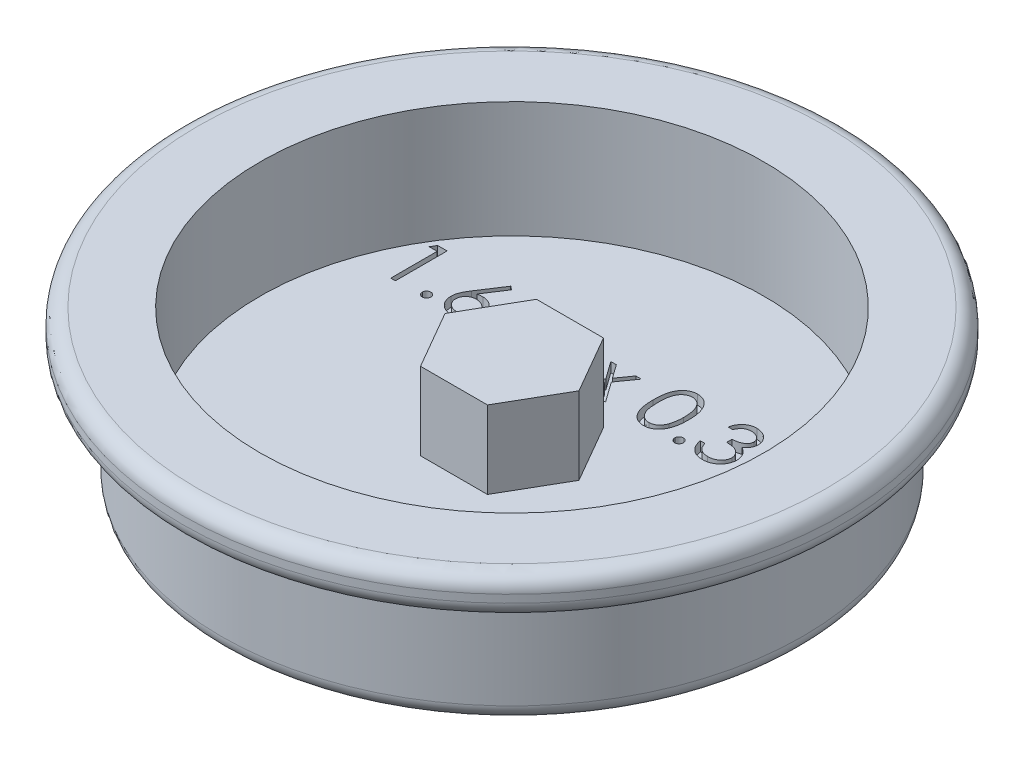
from build123d import *

# Parameters (mm, degrees)
BOSS_EXTRUDE1_DEPTH = 6.35
CUT_EXTRUDE1_DEPTH  = 0.79375


with BuildPart() as part:
    # Sketch1 → Revolve1 (revolve)
    with BuildSketch(Plane.XY):
        with BuildLine():
            Line((0, 0), (22.5425, 0))
            ThreePointArc((22.5425, 0), (23.440525612, 0.371974388), (23.8125, 1.27))
            Line((23.8125, 1.27), (23.8125, 8.255))
            ThreePointArc((23.8125, 8.255), (24.184474388, 9.153025612), (25.0825, 9.525))
            Line((25.0825, 9.525), (25.7175, 9.525))
            ThreePointArc((25.7175, 9.525), (26.615525612, 9.896974388), (26.9875, 10.795))
            Line((26.9875, 10.795), (26.9875, 11.43))
            ThreePointArc((26.9875, 11.43), (26.615525612, 12.328025612), (25.7175, 12.7))
            Line((25.7175, 12.7), (20.6375, 12.7))
            Line((20.6375, 12.7), (20.6375, 3.175))
            Line((20.6375, 3.175), (0, 3.175))
            Line((0, 3.175), (0, 0))
        make_face()
    revolve(axis=Axis((0, 3.175, 0), (0, -1, 0)))

    # Sketch2 → Boss-Extrude1 (add)
    with BuildSketch(Plane(origin=(0, 3.175, 0), x_dir=(1, 0, 0), z_dir=(0, 1, 0))):
        Polygon((2.742298309, 4.7498), (-2.742298309, 4.7498), (-5.484596617, 0), (-2.742298309, -4.7498), (2.742298309, -4.7498), (5.484596617, 0), align=None)
    extrude(amount=BOSS_EXTRUDE1_DEPTH)

    # Sketch3 → Cut-Extrude1 (cut)
    # profile 1 of 11: a face of its own
    with BuildSketch(Plane(origin=(0, 3.175, 0), x_dir=(1, 0, 0), z_dir=(0, 1, 0))):
        Polygon((-16.964111851, 10.86829198), (-16.181386156, 10.86829198), (-16.181386156, 6.634958647), (-16.561300686, 6.634958647), (-16.561300686, 10.434103946), (-17.212582738, 10.434103946), align=None)
    # profile 2 of 11: a face of its own
    with BuildSketch(Plane(origin=(0, 3.175, 0), x_dir=(1, 0, 0), z_dir=(0, 1, 0))):
        with BuildLine():
            add(Edge.make_bspline(
                [(-13.929035729, 7.286240698), (-13.905461853, 7.284839868), (-13.859248026, 7.282093704), (-13.792434985, 7.263253346), (-13.731965254, 7.229799538), (-13.678102444, 7.18521313), (-13.633705086, 7.131152661), (-13.59905906, 7.071165229), (-13.580382821, 7.003792826), (-13.577656661, 6.957311219), (-13.576257951, 6.93346292)],
                knots=[0, 0, 0, 0, 1.020151414, 1.999887582, 2.974338812, 3.990962822, 5.007586832, 5.987933904, 6.967670073, 8, 8, 8, 8], degree=3))
            add(Edge.make_bspline(
                [(-13.576257951, 6.93346292), (-13.577704059, 6.910187655), (-13.580555762, 6.864289173), (-13.59901625, 6.797424928), (-13.63396913, 6.737400005), (-13.677796216, 6.682605991), (-13.731978569, 6.637925128), (-13.792577945, 6.60475594), (-13.859091181, 6.584566593), (-13.905435687, 6.581994786), (-13.929035729, 6.580685143)],
                knots=[0, 0, 0, 0, 1.009421747, 1.99056486, 2.972319754, 3.999869655, 5.017953583, 5.993804169, 6.978383603, 8, 8, 8, 8], degree=3))
            add(Edge.make_bspline(
                [(-13.929035729, 6.580685143), (-13.952652777, 6.581947398), (-13.998759441, 6.584411652), (-14.065024405, 6.605170475), (-14.125992834, 6.637614089), (-14.180164637, 6.682689303), (-14.224358789, 6.737118048), (-14.257772347, 6.797838316), (-14.277838527, 6.864097769), (-14.280477554, 6.910149956), (-14.281813507, 6.93346292)],
                knots=[0, 0, 0, 0, 1.022052826, 1.995314843, 2.982371812, 4.00089066, 5.028879526, 6.005146991, 6.990147033, 8, 8, 8, 8], degree=3))
            add(Edge.make_bspline(
                [(-14.281813507, 6.93346292), (-14.280528873, 6.957350265), (-14.278020782, 7.003987375), (-14.257730221, 7.070752009), (-14.224618041, 7.131431931), (-14.179859135, 7.185130652), (-14.126005939, 7.23010958), (-14.065171481, 7.262845092), (-13.998599847, 7.282246352), (-13.952625921, 7.284886158), (-13.929035729, 7.286240698)],
                knots=[0, 0, 0, 0, 1.032775665, 2.016367738, 2.991239715, 4.008302682, 5.025365648, 6.011011707, 6.979408107, 8, 8, 8, 8], degree=3))
        make_face()
    # profile 3 of 11: a face of its own
    with BuildSketch(Plane(origin=(0, 3.175, 0), x_dir=(1, 0, 0), z_dir=(0, 1, 0))):
        with BuildLine():
            Line((-11.079676755, 10.976838989), (-10.787108646, 10.747024619))
            Line((-10.787108646, 10.747024619), (-11.905651648, 9.036561211))
            add(Edge.make_bspline(
                [(-11.905651648, 9.036561211), (-11.831180932, 9.048431309), (-11.68591738, 9.071585278), (-11.538880532, 9.075404888), (-11.467223496, 9.077266339)],
                knots=[0, 0, 0, 0, 1.025318673, 2, 2, 2, 2], degree=3))
            add(Edge.make_bspline(
                [(-11.467223496, 9.077266339), (-11.424197715, 9.076109899), (-11.339502745, 9.073833482), (-11.21515547, 9.05631492), (-11.0956679, 9.028707403), (-10.981535283, 8.988463818), (-10.872347962, 8.937056208), (-10.76747935, 8.875444432), (-10.668900728, 8.800447085), (-10.575342635, 8.716669472), (-10.490401289, 8.623878452), (-10.415197869, 8.525421597), (-10.352028321, 8.421401484), (-10.300776054, 8.311870799), (-10.26097682, 8.19699838), (-10.231963192, 8.076931202), (-10.214812637, 7.95158647), (-10.21248371, 7.866341439), (-10.211300686, 7.823039576)],
                knots=[0, 0, 0, 0, 1.04369286, 2.054478336, 3.041073146, 4.015093852, 4.984733326, 5.965804835, 6.960378782, 7.985147595, 9.009457201, 10.008161701, 10.986880575, 11.956520048, 12.937015923, 13.931873656, 14.949455224, 16, 16, 16, 16], degree=3))
            add(Edge.make_bspline(
                [(-10.211300686, 7.823039576), (-10.213021966, 7.763797458), (-10.216409036, 7.64722299), (-10.250159341, 7.477434021), (-10.302603864, 7.31568136), (-10.37756716, 7.164547524), (-10.470679186, 7.024239654), (-10.584226369, 6.899918186), (-10.714181826, 6.789041093), (-10.861123001, 6.696323087), (-11.019259729, 6.620603207), (-11.185390241, 6.566216676), (-11.35790117, 6.53273286), (-11.474988648, 6.528535084), (-11.534217353, 6.526411638)],
                knots=[0, 0, 0, 0, 1.031375318, 2.029502543, 3.004789286, 3.987476834, 4.960371455, 5.9300674, 6.912260825, 7.929083631, 8.949397511, 9.960523116, 10.96833055, 12, 12, 12, 12], degree=3))
            add(Edge.make_bspline(
                [(-11.534217353, 6.526411638), (-11.591181934, 6.52826004), (-11.704018795, 6.531921399), (-11.870005127, 6.564537343), (-12.029496586, 6.617402124), (-12.181375742, 6.690232728), (-12.322068293, 6.782226548), (-12.447938158, 6.892973305), (-12.558357733, 7.020105705), (-12.650250846, 7.16360403), (-12.723135217, 7.317806169), (-12.777793507, 7.478596825), (-12.809720392, 7.645390136), (-12.814181789, 7.7584578), (-12.816428892, 7.815407365)],
                knots=[0, 0, 0, 0, 1.012016664, 2.004627821, 2.994792927, 3.992885782, 4.990978636, 5.973936114, 6.964471063, 7.975201453, 8.993600317, 9.990122807, 10.98767138, 12, 12, 12, 12], degree=3))
            add(Edge.make_bspline(
                [(-12.816428892, 7.815407365), (-12.814999906, 7.859004146), (-12.81208219, 7.948020445), (-12.791709708, 8.08283884), (-12.758974194, 8.220786339), (-12.72231323, 8.33781284), (-12.683577492, 8.433681538), (-12.65134061, 8.510974331), (-12.611215872, 8.590513915), (-12.568430926, 8.675027742), (-12.519134522, 8.762337741), (-12.465533689, 8.853903132), (-12.406146492, 8.948267673), (-12.364514486, 9.012304938), (-12.343231776, 9.045041446)],
                knots=[0, 0, 0, 0, 1.173818275, 2.396712641, 3.66331629, 4.989737886, 5.693666774, 6.447286557, 7.243889047, 8.091586357, 8.998013824, 9.943181721, 10.948533338, 12, 12, 12, 12], degree=3))
            Line((-12.343231776, 9.045041446), (-11.079676755, 10.976838989))
        make_face()
        with BuildLine():
            add(Edge.make_bspline(
                [(-11.546937706, 8.643078305), (-11.579186326, 8.642137243), (-11.642177248, 8.640299075), (-11.734593836, 8.629624722), (-11.822058435, 8.609523567), (-11.905729825, 8.583922384), (-11.984043714, 8.548721541), (-12.057569263, 8.505962698), (-12.126590802, 8.455620892), (-12.190385383, 8.398409314), (-12.248224405, 8.335770455), (-12.298033963, 8.268678747), (-12.340999152, 8.198751092), (-12.375932399, 8.125403219), (-12.403134681, 8.048663167), (-12.422811518, 7.968883885), (-12.433762246, 7.88553039), (-12.435584069, 7.829006316), (-12.436514362, 7.800142942)],
                knots=[0, 0, 0, 0, 1.129588631, 2.206414736, 3.251139165, 4.268635594, 5.265702196, 6.250456724, 7.242448911, 8.251968645, 9.246821453, 10.222880186, 11.173611482, 12.116736599, 13.062300278, 14.020270554, 14.989073742, 16, 16, 16, 16], degree=3))
            add(Edge.make_bspline(
                [(-12.436514362, 7.800142942), (-12.435756762, 7.771537728), (-12.434271223, 7.715447162), (-12.420782227, 7.632789298), (-12.400177889, 7.553245075), (-12.369528077, 7.47722457), (-12.332967936, 7.403569023), (-12.284701496, 7.334946345), (-12.231220241, 7.267188736), (-12.16729215, 7.205501242), (-12.098683892, 7.148101325), (-12.025385295, 7.097929971), (-11.94899182, 7.055008599), (-11.8684721, 7.021370415), (-11.78496853, 6.993763896), (-11.697785384, 6.974337155), (-11.606862026, 6.963354042), (-11.545270729, 6.961529846), (-11.513864789, 6.960599673)],
                knots=[0, 0, 0, 0, 0.989467248, 1.94019797, 2.891935182, 3.827694429, 4.772920941, 5.730924762, 6.725747692, 7.756678648, 8.79901574, 9.819492441, 10.826891316, 11.826466727, 12.835195252, 13.867842842, 14.912794438, 16, 16, 16, 16], degree=3))
            add(Edge.make_bspline(
                [(-11.513864789, 6.960599673), (-11.4824589, 6.961529919), (-11.420867705, 6.963354258), (-11.329943615, 6.974336334), (-11.242763172, 6.993766908), (-11.159249776, 7.021359497), (-11.078766331, 7.055049101), (-11.002439668, 7.097662946), (-10.929834259, 7.14840987), (-10.861180963, 7.20540315), (-10.797518961, 7.267539837), (-10.742755014, 7.334341502), (-10.695966723, 7.404123642), (-10.657946325, 7.476934423), (-10.627634096, 7.553291041), (-10.606925274, 7.632776983), (-10.593464134, 7.715450386), (-10.591974767, 7.771538817), (-10.591215216, 7.800142942)],
                knots=[0, 0, 0, 0, 1.087397944, 2.132534446, 3.165364764, 4.174271784, 5.174024072, 6.181601208, 7.194203697, 8.236725232, 9.267838612, 10.269026844, 11.221737037, 12.171628256, 13.107553087, 14.05945871, 15.010357665, 16, 16, 16, 16], degree=3))
            add(Edge.make_bspline(
                [(-10.591215216, 7.800142942), (-10.591880809, 7.82904397), (-10.59318715, 7.885767289), (-10.607962631, 7.968846599), (-10.628454836, 8.049068515), (-10.65939812, 8.125928854), (-10.699598513, 8.199124308), (-10.748564157, 8.269024626), (-10.805209266, 8.336165712), (-10.870641528, 8.398532157), (-10.941870668, 8.45555767), (-11.01760571, 8.505897515), (-11.096839164, 8.54838201), (-11.179490694, 8.583829648), (-11.266507324, 8.609410441), (-11.35648421, 8.629552935), (-11.450572151, 8.640271756), (-11.514406715, 8.642130873), (-11.546937706, 8.643078305)],
                knots=[0, 0, 0, 0, 0.978206639, 1.919901502, 2.851605144, 3.780102724, 4.718870031, 5.675451981, 6.667674623, 7.690630536, 8.733308323, 9.756129687, 10.767539656, 11.776269907, 12.797430371, 13.836405707, 14.897401972, 16, 16, 16, 16], degree=3))
        make_face(mode=Mode.SUBTRACT)
    # profile 4 of 11: a face of its own
    with BuildSketch(Plane(origin=(0, 3.175, 0), x_dir=(1, 0, 0), z_dir=(0, 1, 0))):
        with BuildLine():
            Line((-9.234377609, 9.565727878), (-9.614292139, 9.565727878))
            add(Edge.make_bspline(
                [(-9.614292139, 9.565727878), (-9.611816059, 9.616129809), (-9.606953103, 9.71511786), (-9.584179839, 9.859442965), (-9.551594207, 9.99739496), (-9.505521686, 10.127866189), (-9.448303617, 10.25201027), (-9.379687298, 10.369334099), (-9.298414736, 10.479390108), (-9.206240877, 10.581158042), (-9.106130237, 10.674518247), (-8.998112577, 10.75513935), (-8.884604782, 10.823256915), (-8.765951223, 10.880202798), (-8.640813208, 10.922947183), (-8.510326323, 10.95466288), (-8.373917272, 10.973744746), (-8.280977436, 10.975795839), (-8.233709874, 10.976838989)],
                knots=[0, 0, 0, 0, 1.10065271, 2.161652631, 3.183658789, 4.190468796, 5.17591951, 6.163126047, 7.15150782, 8.156236427, 9.156009102, 10.134482811, 11.092018607, 12.041330605, 13.001268258, 13.972401359, 14.968799086, 16, 16, 16, 16], degree=3))
            add(Edge.make_bspline(
                [(-8.233709874, 10.976838989), (-8.18729068, 10.975752284), (-8.096078621, 10.973616949), (-7.962955994, 10.955279323), (-7.836225362, 10.926558465), (-7.716134444, 10.886262675), (-7.603641395, 10.832094844), (-7.497901141, 10.76702544), (-7.397654827, 10.691769073), (-7.307416146, 10.603166841), (-7.224553993, 10.508579195), (-7.153068408, 10.407598588), (-7.091850582, 10.303302214), (-7.040823578, 10.19489477), (-7.003260439, 10.081355526), (-6.974742035, 9.964337481), (-6.958622211, 9.842629376), (-6.956148222, 9.760252875), (-6.95489043, 9.718372108)],
                knots=[0, 0, 0, 0, 1.111607364, 2.184268762, 3.212621178, 4.221274766, 5.211760367, 6.196651075, 7.1921475, 8.207485113, 9.220403448, 10.201281604, 11.166441695, 12.114753415, 13.065576456, 14.026450734, 14.996634279, 16, 16, 16, 16], degree=3))
            add(Edge.make_bspline(
                [(-6.95489043, 9.718372108), (-6.956938472, 9.659410442), (-6.960998615, 9.542521802), (-6.995729337, 9.370751445), (-7.04997226, 9.204328928), (-7.115283349, 9.070389525), (-7.181169067, 8.962459489), (-7.240541576, 8.873597342), (-7.310046633, 8.777917394), (-7.390695864, 8.675740043), (-7.480820957, 8.566264949), (-7.58123824, 8.449558244), (-7.692663785, 8.326825722), (-7.770869781, 8.242998947), (-7.811394169, 8.199562012)],
                knots=[0, 0, 0, 0, 1.184426356, 2.348067706, 3.509069118, 4.696110526, 5.333549288, 6.050745305, 6.844228056, 7.710549037, 8.667450064, 9.695053472, 10.805634456, 12, 12, 12, 12], degree=3))
            Line((-7.811394169, 8.199562012), (-8.870575526, 7.069146681))
            Line((-8.870575526, 7.069146681), (-6.900616926, 7.069146681))
            Line((-6.900616926, 7.069146681), (-6.900616926, 6.634958647))
            Line((-6.900616926, 6.634958647), (-9.777112652, 6.634958647))
            Line((-9.777112652, 6.634958647), (-8.135339148, 8.386975207))
            add(Edge.make_bspline(
                [(-8.135339148, 8.386975207), (-8.095366942, 8.42870173), (-8.018588515, 8.508849841), (-7.909994351, 8.625862755), (-7.812459574, 8.734416961), (-7.725352823, 8.834307358), (-7.650563726, 8.926995064), (-7.584194455, 9.009478182), (-7.531017026, 9.085381183), (-7.473304119, 9.173362688), (-7.417407208, 9.2807833), (-7.369374168, 9.412057381), (-7.340085732, 9.547194154), (-7.336572264, 9.638515665), (-7.33480496, 9.684451168)],
                knots=[0, 0, 0, 0, 1.329631726, 2.553950428, 3.673215718, 4.687767853, 5.603093632, 6.413772471, 7.123043292, 7.734684054, 8.834405432, 9.900288307, 10.943827018, 12, 12, 12, 12], degree=3))
            add(Edge.make_bspline(
                [(-7.33480496, 9.684451168), (-7.335573905, 9.713336288), (-7.337089349, 9.770263313), (-7.350463898, 9.853727422), (-7.370675653, 9.934239149), (-7.399638012, 10.012046145), (-7.437867117, 10.086366124), (-7.484401586, 10.157289553), (-7.538092425, 10.225856206), (-7.600203008, 10.290146385), (-7.668434084, 10.349027463), (-7.740514748, 10.401187071), (-7.81677535, 10.444777233), (-7.896894355, 10.480510797), (-7.980648399, 10.508541972), (-8.068199471, 10.527965206), (-8.159305663, 10.54016021), (-8.2215157, 10.541810209), (-8.253214415, 10.542650955)],
                knots=[0, 0, 0, 0, 0.991446411, 1.95395049, 2.89581595, 3.838931463, 4.798493298, 5.75982156, 6.748411868, 7.785213223, 8.824556874, 9.840280684, 10.836137867, 11.835679398, 12.848801643, 13.863922112, 14.911575587, 16, 16, 16, 16], degree=3))
            add(Edge.make_bspline(
                [(-8.253214415, 10.542650955), (-8.286320089, 10.541786106), (-8.351334166, 10.540087686), (-8.446788616, 10.52820694), (-8.537848556, 10.507710543), (-8.624743048, 10.479677803), (-8.707619119, 10.444046987), (-8.786073724, 10.399667448), (-8.859930743, 10.346710271), (-8.929329014, 10.286668836), (-8.993269255, 10.219821357), (-9.049447857, 10.145302639), (-9.098535189, 10.064473289), (-9.1413635, 9.977551404), (-9.176144192, 9.883748261), (-9.20272124, 9.783396847), (-9.223751045, 9.67693289), (-9.230776589, 9.603411883), (-9.234377609, 9.565727878)],
                knots=[0, 0, 0, 0, 1.031018746, 2.02475058, 2.990194455, 3.934040569, 4.864654155, 5.795059489, 6.735614925, 7.690564532, 8.649604399, 9.611025574, 10.590972636, 11.591080095, 12.624614302, 13.701020113, 14.821632451, 16, 16, 16, 16], degree=3))
        make_face()
    # profile 5 of 11: a face of its own
    with BuildSketch(Plane(origin=(0, 3.175, 0), x_dir=(1, 0, 0), z_dir=(0, 1, 0))):
        with BuildLine():
            Line((-3.861300686, 10.86829198), (-3.861300686, 10.434103946))
            Line((-3.861300686, 10.434103946), (-5.301244597, 10.434103946))
            Line((-5.301244597, 10.434103946), (-5.529362919, 9.320649085))
            add(Edge.make_bspline(
                [(-5.529362919, 9.320649085), (-5.484542957, 9.333022842), (-5.397711369, 9.35699504), (-5.269550394, 9.383611543), (-5.147881729, 9.399656414), (-5.068929614, 9.401847237), (-5.030725099, 9.402907365)],
                knots=[0, 0, 0, 0, 1.100273476, 2.13160584, 3.095893838, 4, 4, 4, 4], degree=3))
            add(Edge.make_bspline(
                [(-5.030725099, 9.402907365), (-4.983452385, 9.401884186), (-4.890502419, 9.399872359), (-4.754504835, 9.380554027), (-4.624683145, 9.350146702), (-4.50130885, 9.307667595), (-4.384153708, 9.253348203), (-4.27429561, 9.185493989), (-4.170085562, 9.106229865), (-4.073393092, 9.015098279), (-3.985673214, 8.914802609), (-3.908546731, 8.806964041), (-3.843035789, 8.692630583), (-3.790348019, 8.570709847), (-3.748275538, 8.442549728), (-3.720272649, 8.306801748), (-3.701625773, 8.16474545), (-3.699542505, 8.06761516), (-3.698480174, 8.018084982)],
                knots=[0, 0, 0, 0, 1.052922333, 2.070308379, 3.05430497, 4.020497103, 4.973039431, 5.925935799, 6.892292201, 7.88610001, 8.88166317, 9.857072816, 10.836096531, 11.812156883, 12.81219415, 13.836441305, 14.89672472, 16, 16, 16, 16], degree=3))
            add(Edge.make_bspline(
                [(-3.698480174, 8.018084982), (-3.699284598, 7.983586678), (-3.700882576, 7.915056283), (-3.709008867, 7.813281869), (-3.724654924, 7.713662061), (-3.7456616, 7.616183645), (-3.772927191, 7.521031166), (-3.805933951, 7.42793227), (-3.846327242, 7.337466413), (-3.890633762, 7.248777601), (-3.94052236, 7.163870836), (-3.995892554, 7.084466823), (-4.054391767, 7.009374407), (-4.117337062, 6.939398939), (-4.185313504, 6.875000241), (-4.257497845, 6.815796129), (-4.333314086, 6.760785378), (-4.413935188, 6.712200989), (-4.497564668, 6.667493414), (-4.585410226, 6.630816373), (-4.675472216, 6.598025544), (-4.769046875, 6.571888306), (-4.865922248, 6.551407978), (-4.966258024, 6.537497728), (-5.069527978, 6.527366227), (-5.139529183, 6.526732005), (-5.174889094, 6.526411638)],
                knots=[0, 0, 0, 0, 1.056347294, 2.098418968, 3.122841568, 4.141288669, 5.149314143, 6.15115421, 7.162517403, 8.180376062, 9.185164535, 10.17417709, 11.141909838, 12.097768115, 13.052685741, 14.0056014, 14.954263652, 15.917497458, 16.885230207, 17.854509472, 18.828990115, 19.81800267, 20.826176721, 21.857883937, 22.917946725, 24, 24, 24, 24], degree=3))
            add(Edge.make_bspline(
                [(-5.174889094, 6.526411638), (-5.217070246, 6.527247223), (-5.30005668, 6.528891138), (-5.421638699, 6.546088735), (-5.538617317, 6.570719376), (-5.650050868, 6.607774674), (-5.756938016, 6.654205021), (-5.857839779, 6.712886486), (-5.955334384, 6.779385021), (-6.045458467, 6.857859352), (-6.129104433, 6.943633558), (-6.203981829, 7.036715658), (-6.270667203, 7.135569364), (-6.328092668, 7.24067475), (-6.377075989, 7.35175564), (-6.415556975, 7.469228222), (-6.446615557, 7.592478703), (-6.459755123, 7.677331044), (-6.466428892, 7.720428732)],
                knots=[0, 0, 0, 0, 1.0467383, 2.05933395, 3.04377827, 4.011590433, 4.970194871, 5.932262533, 6.905835911, 7.896367577, 8.894135286, 9.877477877, 10.858688626, 11.851381753, 12.8477658, 13.868841284, 14.917554742, 16, 16, 16, 16], degree=3))
            Line((-6.466428892, 7.720428732), (-6.086514362, 7.720428732))
            add(Edge.make_bspline(
                [(-6.086514362, 7.720428732), (-6.077166487, 7.680059118), (-6.059199354, 7.602466479), (-6.019761925, 7.493450476), (-5.971543199, 7.396302462), (-5.914206511, 7.309737347), (-5.845807903, 7.234252179), (-5.767758022, 7.166982018), (-5.680251728, 7.106294005), (-5.583014203, 7.055708372), (-5.480430764, 7.012566166), (-5.37306471, 6.983837925), (-5.263839453, 6.963637798), (-5.18996371, 6.961615763), (-5.152840483, 6.960599673)],
                knots=[0, 0, 0, 0, 1.136247022, 2.183929868, 3.172523383, 4.106158343, 5.02341133, 5.958108904, 6.928429099, 7.938127109, 8.96079061, 9.975095812, 10.982467395, 12, 12, 12, 12], degree=3))
            add(Edge.make_bspline(
                [(-5.152840483, 6.960599673), (-5.116605032, 6.961592423), (-5.04525713, 6.963547157), (-4.940256691, 6.978592438), (-4.838883024, 7.001763977), (-4.742136412, 7.036440849), (-4.648323883, 7.078586365), (-4.559818466, 7.132670314), (-4.474059747, 7.194912432), (-4.393713338, 7.26622188), (-4.320126576, 7.344804272), (-4.255107268, 7.428838834), (-4.200948525, 7.518484924), (-4.155308221, 7.612190547), (-4.120651374, 7.710982707), (-4.095927521, 7.814398414), (-4.081409535, 7.922693104), (-4.079412394, 7.996557889), (-4.078394703, 8.034197429)],
                knots=[0, 0, 0, 0, 1.027316725, 2.022795036, 3.002884548, 3.971462791, 4.93288096, 5.914575861, 6.907176829, 7.935150275, 8.956128384, 9.956726525, 10.942570165, 11.921478529, 12.907843606, 13.90538589, 14.932640048, 16, 16, 16, 16], degree=3))
            add(Edge.make_bspline(
                [(-4.078394703, 8.034197429), (-4.07919115, 8.068155719), (-4.080750081, 8.13462424), (-4.093487056, 8.231868995), (-4.115641871, 8.32388115), (-4.146392659, 8.411105033), (-4.185435492, 8.493622911), (-4.233146746, 8.571519946), (-4.290421808, 8.64376944), (-4.355847235, 8.710405195), (-4.427521247, 8.771903282), (-4.506677012, 8.824328986), (-4.591658066, 8.868432963), (-4.681440534, 8.906494256), (-4.778159983, 8.933830396), (-4.879901052, 8.954353457), (-4.987762404, 8.966225372), (-5.061507903, 8.967872608), (-5.099415003, 8.968719331)],
                knots=[0, 0, 0, 0, 1.045622112, 2.046656509, 3.013763289, 3.955457236, 4.890082067, 5.820317437, 6.762574623, 7.722996705, 8.69280354, 9.665887285, 10.63943826, 11.638615906, 12.663482002, 13.728887084, 14.832589034, 16, 16, 16, 16], degree=3))
            add(Edge.make_bspline(
                [(-5.099415003, 8.968719331), (-5.132228088, 8.968017092), (-5.199978784, 8.966567147), (-5.303904489, 8.955891289), (-5.413114478, 8.938668523), (-5.527190106, 8.91497849), (-5.646473958, 8.883977093), (-5.77071431, 8.846827173), (-5.900172385, 8.802411041), (-5.987400489, 8.768868268), (-6.032240857, 8.751625314)],
                knots=[0, 0, 0, 0, 0.817624296, 1.688186739, 2.600797293, 3.572016777, 4.590301741, 5.671205678, 6.80286297, 8, 8, 8, 8], degree=3))
            Line((-6.032240857, 8.751625314), (-5.598052823, 10.86829198))
            Line((-5.598052823, 10.86829198), (-3.861300686, 10.86829198))
        make_face()
    # profile 6 of 11: a face of its own
    with BuildSketch(Plane(origin=(0, 3.175, 0), x_dir=(1, 0, 0), z_dir=(0, 1, 0))):
        Polygon((-1.636087011, 9.728548391), (-1.184090483, 9.728548391), (-0.387796413, 8.612549459), (0.408497658, 9.728548391), (0.860494185, 9.728548391), (-0.161374137, 8.296236692), (1.023314698, 6.634958647), (0.57131817, 6.634958647), (-0.387796413, 7.979075901), (-1.346910996, 6.634958647), (-1.798907524, 6.634958647), (-0.613370665, 8.296236692), align=None)
    # profile 7 of 11: a face of its own
    with BuildSketch(Plane(origin=(0, 3.175, 0), x_dir=(1, 0, 0), z_dir=(0, 1, 0))):
        with BuildLine():
            add(Edge.make_bspline(
                [(2.814340339, 8.749929267), (2.814737085, 8.817780393), (2.815507769, 8.949582183), (2.824081383, 9.141635988), (2.83832394, 9.321807005), (2.857842477, 9.490103856), (2.881595082, 9.64656999), (2.913303337, 9.790787268), (2.949362631, 9.923423173), (2.991154637, 10.044910222), (3.038311296, 10.156885158), (3.089636545, 10.261418497), (3.147167296, 10.358352072), (3.207615562, 10.449233019), (3.273428259, 10.532573678), (3.34273251, 10.609550994), (3.418233256, 10.678385901), (3.497363942, 10.741095238), (3.580840999, 10.796067457), (3.666284985, 10.844488007), (3.754284018, 10.885853561), (3.845078354, 10.918378183), (3.937851924, 10.945242731), (4.032929042, 10.963614125), (4.130466692, 10.975173433), (4.196302809, 10.976278536), (4.229691568, 10.976838989)],
                knots=[0, 0, 0, 0, 1.646270934, 3.197905019, 4.663502075, 6.030701355, 7.308322542, 8.50163776, 9.611534131, 10.641858119, 11.616356847, 12.558055219, 13.465016945, 14.349605745, 15.204443733, 16.039544428, 16.859896111, 17.680448484, 18.487036065, 19.28249412, 20.06191084, 20.843045899, 21.620316918, 22.403196591, 23.190181807, 24, 24, 24, 24], degree=3))
            add(Edge.make_bspline(
                [(4.229691568, 10.976838989), (4.263359242, 10.976248965), (4.330313653, 10.975075593), (4.429301535, 10.963798062), (4.526002579, 10.94508537), (4.620004518, 10.91857143), (4.712079501, 10.885677611), (4.801507347, 10.844448431), (4.888843531, 10.796455897), (4.972700165, 10.740063207), (5.053997842, 10.677189406), (5.130739664, 10.606114559), (5.202932616, 10.527556327), (5.271482747, 10.442355216), (5.334445231, 10.348877065), (5.394405478, 10.248747714), (5.448074512, 10.140216096), (5.499763119, 10.025093054), (5.544378808, 9.9001932), (5.584615123, 9.766220585), (5.617125876, 9.621592759), (5.644206234, 9.467068539), (5.665185299, 9.30208044), (5.68046478, 9.126982134), (5.688536035, 8.941658424), (5.690056045, 8.814951311), (5.690836066, 8.749929267)],
                knots=[0, 0, 0, 0, 0.810914788, 1.612654377, 2.396697861, 3.181598691, 3.963628158, 4.749916497, 5.551656086, 6.361998678, 7.18212741, 8.025565596, 8.878627764, 9.750805457, 10.657531673, 11.591944965, 12.560506719, 13.57287815, 14.630710178, 15.753379473, 16.941251878, 18.199788006, 19.531962791, 20.947069417, 22.433333509, 24, 24, 24, 24], degree=3))
            add(Edge.make_bspline(
                [(5.690836066, 8.749929267), (5.690047959, 8.685190826), (5.688512364, 8.559050613), (5.680555262, 8.374560767), (5.664881489, 8.200391705), (5.645275122, 8.036125717), (5.618120148, 7.882446502), (5.584731042, 7.738822264), (5.547658747, 7.604632768), (5.501896662, 7.480977329), (5.451809422, 7.36613096), (5.39731409, 7.258885933), (5.338930586, 7.158294322), (5.275323247, 7.065161294), (5.207525309, 6.978827109), (5.134085698, 6.900815699), (5.057074609, 6.829247362), (4.975537687, 6.765563965), (4.890373239, 6.709823297), (4.803337022, 6.659974163), (4.71288474, 6.619778428), (4.621066216, 6.585264616), (4.526568097, 6.55889645), (4.429508177, 6.540664263), (4.330380158, 6.527877361), (4.263370646, 6.526901904), (4.229691568, 6.526411638)],
                knots=[0, 0, 0, 0, 1.561518951, 3.042555995, 4.452378317, 5.7783523, 7.031515105, 8.214008947, 9.334062868, 10.386615937, 11.391082383, 12.354592575, 13.286541444, 14.194233754, 15.072674879, 15.931287219, 16.775624067, 17.606195743, 18.42308326, 19.229000347, 20.022332153, 20.807536673, 21.593273796, 22.3848459, 23.188221202, 24, 24, 24, 24], degree=3))
            add(Edge.make_bspline(
                [(4.229691568, 6.526411638), (4.196303735, 6.526975706), (4.130469445, 6.528087938), (4.032918416, 6.539595023), (3.938233937, 6.558095299), (3.845948777, 6.583999191), (3.755589468, 6.61570666), (3.668387293, 6.657016353), (3.583372666, 6.704591846), (3.500772403, 6.758772975), (3.422138646, 6.820847773), (3.347028905, 6.889505531), (3.277330072, 6.966459562), (3.212458357, 7.050494764), (3.150803983, 7.140838019), (3.09409017, 7.238722814), (3.041632089, 7.343761019), (2.993682343, 7.456631253), (2.951169198, 7.578980547), (2.913616256, 7.712208601), (2.883965799, 7.857491323), (2.858586414, 8.013661853), (2.83811597, 8.181391273), (2.824140739, 8.360770643), (2.815503148, 8.551688181), (2.814735015, 8.682643051), (2.814340339, 8.749929267)],
                knots=[0, 0, 0, 0, 0.810891512, 1.598919785, 2.382837074, 3.152667961, 3.926044502, 4.706494248, 5.493654104, 6.291793342, 7.103789334, 7.925228297, 8.761435821, 9.622817696, 10.50288917, 11.416980706, 12.369136599, 13.353924996, 14.394355917, 15.514179734, 16.714354668, 17.994756427, 19.357759367, 20.818452758, 22.365282078, 24, 24, 24, 24], degree=3))
        make_face()
        with BuildLine():
            add(Edge.make_bspline(
                [(3.194254869, 8.751625314), (3.194399343, 8.695081649), (3.194679739, 8.5853415), (3.202004858, 8.425873937), (3.21198371, 8.277138396), (3.224854612, 8.138946023), (3.243968655, 8.01176458), (3.265385436, 7.894719344), (3.291448364, 7.788429733), (3.322285195, 7.692166381), (3.357408674, 7.604295603), (3.395757671, 7.522530324), (3.436954926, 7.445904649), (3.483060946, 7.375106856), (3.533274404, 7.309906067), (3.586461108, 7.24914826), (3.644606043, 7.194965244), (3.725043903, 7.129981334), (3.831235829, 7.06282962), (3.965033904, 7.004353873), (4.102518601, 6.967605569), (4.195834875, 6.962932264), (4.24241192, 6.960599673)],
                knots=[0, 0, 0, 0, 1.459021318, 2.831673884, 4.118529203, 5.306027144, 6.411944654, 7.436330062, 8.375795394, 9.233974572, 10.042671642, 10.816086306, 11.563610507, 12.285937304, 12.993564865, 13.685989202, 14.367179055, 15.041617293, 16.353048772, 17.594441528, 18.799311195, 20, 20, 20, 20], degree=3))
            add(Edge.make_bspline(
                [(4.24241192, 6.960599673), (4.289290247, 6.962532227), (4.382950114, 6.966393344), (4.519788133, 7.003645151), (4.65263046, 7.059851165), (4.756736521, 7.126311481), (4.835939216, 7.189603841), (4.892686433, 7.243566321), (4.944771006, 7.303989132), (4.994170468, 7.369181613), (5.039478112, 7.440389285), (5.080678288, 7.517269733), (5.118274337, 7.600036453), (5.139693849, 7.65781509), (5.150645094, 7.687355816)],
                knots=[0, 0, 0, 0, 1.353760809, 2.704726607, 4.075137775, 5.516104923, 6.260822281, 7.007110065, 7.778089737, 8.566572457, 9.372053459, 10.217411131, 11.088608312, 12, 12, 12, 12], degree=3))
            add(Edge.make_bspline(
                [(5.150645094, 7.687355816), (5.163407708, 7.725128929), (5.189321288, 7.801824549), (5.222718387, 7.920797728), (5.249019965, 8.045623928), (5.272682322, 8.175557165), (5.288833161, 8.31155566), (5.301832897, 8.45319862), (5.309490013, 8.600592839), (5.310439188, 8.700735352), (5.310921536, 8.751625314)],
                knots=[0, 0, 0, 0, 0.884706709, 1.796334032, 2.740027952, 3.714592787, 4.726048262, 5.777819803, 6.87074269, 8, 8, 8, 8], degree=3))
            add(Edge.make_bspline(
                [(5.310921536, 8.751625314), (5.310256069, 8.802507044), (5.308954273, 8.902042586), (5.303978307, 9.047812195), (5.291128841, 9.186263678), (5.276857526, 9.317993487), (5.255815173, 9.442272425), (5.233127158, 9.560140889), (5.202645692, 9.670138643), (5.170085583, 9.773987852), (5.132819676, 9.870508643), (5.091797788, 9.960151032), (5.047986709, 10.043347795), (5.000401332, 10.119870667), (4.949606554, 10.190062409), (4.894261708, 10.252515681), (4.836562134, 10.309166109), (4.755745156, 10.373830359), (4.64994292, 10.439763553), (4.518291518, 10.500440234), (4.381287977, 10.53528455), (4.288670561, 10.540197257), (4.24241192, 10.542650955)],
                knots=[0, 0, 0, 0, 1.31362396, 2.569729283, 3.763502607, 4.902122613, 5.988968491, 7.01645872, 7.998833611, 8.933434873, 9.825090667, 10.667526885, 11.477055099, 12.250526234, 12.991942729, 13.710640831, 14.402115721, 15.076753259, 16.378508321, 17.609869233, 18.806226677, 20, 20, 20, 20], degree=3))
            add(Edge.make_bspline(
                [(4.24241192, 10.542650955), (4.195590538, 10.540193872), (4.101862475, 10.535275229), (3.963434948, 10.500570056), (3.830744923, 10.440078183), (3.725222468, 10.37361198), (3.644349126, 10.310307546), (3.587401488, 10.255411549), (3.534005641, 10.195363222), (3.48481709, 10.129562811), (3.438747195, 10.058847557), (3.396436827, 9.982661147), (3.358315867, 9.900617497), (3.323137428, 9.812786189), (3.292206532, 9.716531142), (3.266692881, 9.610372454), (3.243122826, 9.4936995), (3.22643712, 9.365829238), (3.211603815, 9.227602252), (3.202071137, 9.078495401), (3.194655235, 8.918760388), (3.194390997, 8.808452834), (3.194254869, 8.751625314)],
                knots=[0, 0, 0, 0, 1.207732386, 2.417664972, 3.655092373, 4.956220595, 5.625982001, 6.301752483, 6.994047911, 7.697131622, 8.419323945, 9.170223765, 9.943494443, 10.752040957, 11.610060368, 12.549350801, 13.567764191, 14.679664412, 15.874934091, 17.154273443, 18.533957287, 20, 20, 20, 20], degree=3))
        make_face(mode=Mode.SUBTRACT)
    # profile 8 of 11: a face of its own
    with BuildSketch(Plane(origin=(0, 3.175, 0), x_dir=(1, 0, 0), z_dir=(0, 1, 0))):
        with BuildLine():
            add(Edge.make_bspline(
                [(6.749169399, 7.286240698), (6.772743275, 7.284839868), (6.818957102, 7.282093704), (6.885770143, 7.263253346), (6.946239874, 7.229799538), (7.000102685, 7.18521313), (7.044500042, 7.131152661), (7.079146068, 7.071165229), (7.097822307, 7.003792826), (7.100548467, 6.957311219), (7.101947177, 6.93346292)],
                knots=[0, 0, 0, 0, 1.020151414, 1.999887582, 2.974338812, 3.990962822, 5.007586832, 5.987933904, 6.967670073, 8, 8, 8, 8], degree=3))
            add(Edge.make_bspline(
                [(7.101947177, 6.93346292), (7.100501069, 6.910187655), (7.097649366, 6.864289173), (7.079188878, 6.797424928), (7.044235999, 6.737400005), (7.000408912, 6.682605991), (6.946226559, 6.637925128), (6.885627183, 6.60475594), (6.819113947, 6.584566593), (6.772769441, 6.581994786), (6.749169399, 6.580685143)],
                knots=[0, 0, 0, 0, 1.009421747, 1.99056486, 2.972319754, 3.999869655, 5.017953583, 5.993804169, 6.978383603, 8, 8, 8, 8], degree=3))
            add(Edge.make_bspline(
                [(6.749169399, 6.580685143), (6.725552351, 6.581947398), (6.679445688, 6.584411652), (6.613180723, 6.605170475), (6.552212294, 6.637614089), (6.498040491, 6.682689303), (6.453846339, 6.737118048), (6.420432781, 6.797838316), (6.400366601, 6.864097769), (6.397727574, 6.910149956), (6.396391621, 6.93346292)],
                knots=[0, 0, 0, 0, 1.022052826, 1.995314843, 2.982371812, 4.00089066, 5.028879526, 6.005146991, 6.990147033, 8, 8, 8, 8], degree=3))
            add(Edge.make_bspline(
                [(6.396391621, 6.93346292), (6.397676256, 6.957350265), (6.400184347, 7.003987375), (6.420474907, 7.070752009), (6.453587087, 7.131431931), (6.498345993, 7.185130652), (6.552199189, 7.23010958), (6.613033647, 7.262845092), (6.679605282, 7.282246352), (6.725579207, 7.284886158), (6.749169399, 7.286240698)],
                knots=[0, 0, 0, 0, 1.032775665, 2.016367738, 2.991239715, 4.008302682, 5.025365648, 6.011011707, 6.979408107, 8, 8, 8, 8], degree=3))
        make_face()
    # profile 9 of 11: a face of its own
    with BuildSketch(Plane(origin=(0, 3.175, 0), x_dir=(1, 0, 0), z_dir=(0, 1, 0))):
        with BuildLine():
            Line((8.187417262, 9.891368903), (7.807502732, 9.891368903))
            add(Edge.make_bspline(
                [(7.807502732, 9.891368903), (7.817795237, 9.933983432), (7.83791624, 10.017291349), (7.879883782, 10.136317274), (7.925602881, 10.24895239), (7.980502083, 10.353087641), (8.0403841, 10.450815838), (8.108991583, 10.539920398), (8.183159247, 10.622667508), (8.265195138, 10.696101615), (8.351226948, 10.762598487), (8.442466917, 10.819294985), (8.537079369, 10.868068008), (8.635719825, 10.90824867), (8.738681956, 10.938517636), (8.845034929, 10.960478725), (8.955057449, 10.974740358), (9.02974263, 10.976132234), (9.06766566, 10.976838989)],
                knots=[0, 0, 0, 0, 1.162005537, 2.271625781, 3.343758855, 4.383309926, 5.390229558, 6.379919256, 7.361854164, 8.333198761, 9.295911338, 10.242430842, 11.177959212, 12.116337295, 13.062827104, 14.020064771, 14.994644689, 16, 16, 16, 16], degree=3))
            add(Edge.make_bspline(
                [(9.06766566, 10.976838989), (9.122920024, 10.975170777), (9.232223494, 10.971870742), (9.392803561, 10.941736138), (9.547655047, 10.894050501), (9.695082994, 10.828163232), (9.832023384, 10.746898577), (9.9538662, 10.650179323), (10.058959923, 10.539871597), (10.147127408, 10.418033162), (10.216160979, 10.28782126), (10.267065449, 10.153805832), (10.298055482, 10.016304781), (10.302071775, 9.923465024), (10.304083929, 9.876952504)],
                knots=[0, 0, 0, 0, 1.083050992, 2.142477498, 3.193116406, 4.255571735, 5.30263384, 6.308962982, 7.297363603, 8.282367274, 9.249857812, 10.179914175, 11.08814088, 12, 12, 12, 12], degree=3))
            add(Edge.make_bspline(
                [(10.304083929, 9.876952504), (10.302676538, 9.832191904), (10.299922492, 9.744602358), (10.276537915, 9.61672969), (10.23718453, 9.496210802), (10.182671579, 9.382538348), (10.112106085, 9.276433066), (10.026625776, 9.177656227), (9.925627318, 9.085769721), (9.849089936, 9.033131882), (9.809686226, 9.006032365)],
                knots=[0, 0, 0, 0, 1.024540389, 2.004866551, 2.965041327, 3.920577974, 4.882998113, 5.874504559, 6.905732034, 8, 8, 8, 8], degree=3))
            add(Edge.make_bspline(
                [(9.809686226, 9.006032365), (9.85471892, 8.984287338), (9.94394171, 8.941204152), (10.06555997, 8.85671195), (10.175962733, 8.759156177), (10.237531994, 8.68302554), (10.268466942, 8.644774352)],
                knots=[0, 0, 0, 0, 1.015518401, 2.012035669, 3.001164323, 4, 4, 4, 4], degree=3))
            add(Edge.make_bspline(
                [(10.268466942, 8.644774352), (10.288836946, 8.616885452), (10.329243383, 8.561564353), (10.379118742, 8.472620295), (10.424365957, 8.382690399), (10.459623841, 8.28936426), (10.486927471, 8.193723567), (10.506444386, 8.095604098), (10.518568823, 7.994925728), (10.520305157, 7.926814442), (10.521177946, 7.892577504)],
                knots=[0, 0, 0, 0, 1.025084078, 2.033381695, 3.024893161, 4.013698104, 4.991890475, 5.976764909, 6.982997093, 8, 8, 8, 8], degree=3))
            add(Edge.make_bspline(
                [(10.521177946, 7.892577504), (10.519007439, 7.833299079), (10.51467664, 7.715021195), (10.47596695, 7.540275579), (10.415958554, 7.369459972), (10.330739213, 7.206083738), (10.226880416, 7.053223658), (10.1033187, 6.91645517), (9.961457997, 6.798891143), (9.80324545, 6.700665439), (9.631835209, 6.622145667), (9.448500922, 6.567647617), (9.25588419, 6.532152931), (9.123795363, 6.528346718), (9.056641354, 6.526411638)],
                knots=[0, 0, 0, 0, 0.955779014, 1.907060117, 2.875433937, 3.871313158, 4.872415639, 5.851225146, 6.836215519, 7.83643374, 8.849228613, 9.86973379, 10.916971861, 12, 12, 12, 12], degree=3))
            add(Edge.make_bspline(
                [(9.056641354, 6.526411638), (9.01138182, 6.527461763), (8.922326148, 6.529528058), (8.791403059, 6.543653604), (8.666433004, 6.569452753), (8.547247014, 6.604170085), (8.433739208, 6.648186763), (8.326255957, 6.703000807), (8.224135991, 6.767482339), (8.128342974, 6.842392488), (8.038888325, 6.926189918), (7.958149316, 7.020362244), (7.884779852, 7.123168628), (7.82074447, 7.235803181), (7.763126441, 7.356810302), (7.715736141, 7.487739438), (7.674025025, 7.627420112), (7.654632168, 7.724759855), (7.64468222, 7.774702237)],
                knots=[0, 0, 0, 0, 1.048658725, 2.063410685, 3.046034179, 4.001477787, 4.936774919, 5.862367409, 6.792675028, 7.730719943, 8.675894397, 9.627829632, 10.600096036, 11.597688215, 12.626045268, 13.701542398, 14.82072376, 16, 16, 16, 16], degree=3))
            Line((7.64468222, 7.774702237), (8.02459675, 7.774702237))
            add(Edge.make_bspline(
                [(8.02459675, 7.774702237), (8.034494635, 7.742106763), (8.053746883, 7.678705737), (8.086518082, 7.587458891), (8.123853992, 7.503810579), (8.163906839, 7.427147184), (8.205972197, 7.356713707), (8.253040726, 7.294372589), (8.301626263, 7.23738563), (8.338249862, 7.20527929), (8.35617394, 7.189566019)],
                knots=[0, 0, 0, 0, 1.198163088, 2.33053128, 3.407730985, 4.417276592, 5.372219308, 6.28897303, 7.162600585, 8, 8, 8, 8], degree=3))
            add(Edge.make_bspline(
                [(8.35617394, 7.189566019), (8.379876466, 7.171292129), (8.427208353, 7.134800757), (8.504337547, 7.088232121), (8.585454123, 7.047881167), (8.672315682, 7.01705803), (8.763047833, 6.990959335), (8.859117122, 6.973880231), (8.959675985, 6.962162157), (9.028337946, 6.961128097), (9.063425542, 6.960599673)],
                knots=[0, 0, 0, 0, 0.946170439, 1.889420265, 2.845303464, 3.807233317, 4.801018734, 5.828864929, 6.890507805, 8, 8, 8, 8], degree=3))
            add(Edge.make_bspline(
                [(9.063425542, 6.960599673), (9.103041684, 6.961344625), (9.180507628, 6.962801314), (9.293543505, 6.976197645), (9.40107918, 6.995707764), (9.501920719, 7.02584061), (9.597389047, 7.063070783), (9.686145899, 7.10981695), (9.769356428, 7.16466247), (9.845954851, 7.227000309), (9.914831799, 7.295243451), (9.975476734, 7.366621166), (10.027032277, 7.440832502), (10.068620033, 7.518288134), (10.10145927, 7.598667316), (10.123815141, 7.682195614), (10.139359355, 7.768189451), (10.140625257, 7.826644489), (10.141263416, 7.856112493)],
                knots=[0, 0, 0, 0, 1.217147791, 2.380027433, 3.494444702, 4.572153297, 5.609568379, 6.639424714, 7.649109417, 8.668170816, 9.669597737, 10.625200337, 11.543417969, 12.441394052, 13.322311151, 14.205496177, 15.095365482, 16, 16, 16, 16], degree=3))
            add(Edge.make_bspline(
                [(10.141263416, 7.856112493), (10.13941248, 7.895556684), (10.135719818, 7.974248797), (10.107527536, 8.090021482), (10.061155767, 8.201567895), (9.996237587, 8.306984898), (9.917212467, 8.404685274), (9.824847294, 8.491857448), (9.718375056, 8.563787939), (9.620379595, 8.613485648), (9.53357793, 8.647397158), (9.45929456, 8.669984972), (9.376131811, 8.689111965), (9.28509537, 8.706906808), (9.185499289, 8.722051676), (9.077451998, 8.734681301), (8.9609316, 8.744786922), (8.880267047, 8.749299771), (8.838699314, 8.751625314)],
                knots=[0, 0, 0, 0, 1.07054697, 2.135767047, 3.216561865, 4.33974944, 5.486079747, 6.621378074, 7.775625952, 8.963672916, 9.598146892, 10.304877434, 11.070270905, 11.915000392, 12.823868403, 13.805723172, 14.86925407, 16, 16, 16, 16], degree=3))
            Line((8.838699314, 8.751625314), (8.838699314, 9.185813348))
            add(Edge.make_bspline(
                [(8.838699314, 9.185813348), (8.891073105, 9.18670211), (8.993660495, 9.188442978), (9.143513607, 9.209498381), (9.286809898, 9.238624474), (9.420373672, 9.283237992), (9.542110687, 9.335054351), (9.647725825, 9.395351786), (9.735739422, 9.462377244), (9.805723766, 9.537165258), (9.858373404, 9.617374886), (9.896868674, 9.700973129), (9.919608116, 9.788692708), (9.922643618, 9.848557687), (9.924169399, 9.878648551)],
                knots=[0, 0, 0, 0, 1.321986639, 2.589447074, 3.816329219, 5.01088745, 6.139805852, 7.153945165, 8.075214402, 8.924034688, 9.728124013, 10.488707548, 11.240355623, 12, 12, 12, 12], degree=3))
            add(Edge.make_bspline(
                [(9.924169399, 9.878648551), (9.923668159, 9.900755919), (9.922670966, 9.944737479), (9.910095211, 10.008993514), (9.891197562, 10.071285134), (9.865217317, 10.131347438), (9.830443268, 10.188763865), (9.788828408, 10.244023922), (9.739276515, 10.296812112), (9.682494879, 10.346015927), (9.621520601, 10.392908242), (9.554694682, 10.43271807), (9.484032034, 10.466760193), (9.409454423, 10.494832638), (9.330719829, 10.515950063), (9.248198183, 10.531112462), (9.161732128, 10.540592292), (9.102741557, 10.541957138), (9.072753801, 10.542650955)],
                knots=[0, 0, 0, 0, 0.884392785, 1.759457502, 2.611959086, 3.489218968, 4.37281399, 5.2945488, 6.255912374, 7.266815255, 8.301784654, 9.332968512, 10.37626691, 11.440494194, 12.520033166, 13.637162961, 14.798855837, 16, 16, 16, 16], degree=3))
            add(Edge.make_bspline(
                [(9.072753801, 10.542650955), (9.02455226, 10.540968069), (8.930403439, 10.537681002), (8.794676825, 10.508890691), (8.668500106, 10.462955295), (8.572054291, 10.408123928), (8.500834415, 10.353997213), (8.449941357, 10.306726136), (8.399963216, 10.254193102), (8.354187968, 10.193162496), (8.307894682, 10.127767426), (8.265749355, 10.054683544), (8.224795251, 9.975817277), (8.200117882, 9.920063509), (8.187417262, 9.891368903)],
                knots=[0, 0, 0, 0, 1.472543308, 2.876219568, 4.221790263, 5.565193594, 6.249813518, 6.953379497, 7.687249741, 8.463570142, 9.283606569, 10.136032583, 11.040678096, 12, 12, 12, 12], degree=3))
        make_face()
    # profile 10 of 11: a face of its own
    with BuildSketch(Plane(origin=(0, 3.175, 0), x_dir=(1, 0, 0), z_dir=(0, 1, 0))):
        Polygon((11.172459997, 10.86829198), (13.777588203, 10.86829198), (11.552374527, 6.526411638), (11.224189431, 6.707040645), (13.134786386, 10.434103946), (11.172459997, 10.434103946), align=None)
    # profile 11 of 11: a face of its own
    with BuildSketch(Plane(origin=(0, 3.175, 0), x_dir=(1, 0, 0), z_dir=(0, 1, 0))):
        with BuildLine():
            Line((16.816904442, 10.86829198), (16.816904442, 10.434103946))
            Line((16.816904442, 10.434103946), (15.376960532, 10.434103946))
            Line((15.376960532, 10.434103946), (15.148842209, 9.320649085))
            add(Edge.make_bspline(
                [(15.148842209, 9.320649085), (15.193662171, 9.333022842), (15.28049376, 9.35699504), (15.408654734, 9.383611543), (15.530323399, 9.399656414), (15.609275514, 9.401847237), (15.647480029, 9.402907365)],
                knots=[0, 0, 0, 0, 1.100273476, 2.13160584, 3.095893838, 4, 4, 4, 4], degree=3))
            add(Edge.make_bspline(
                [(15.647480029, 9.402907365), (15.694752743, 9.401884186), (15.787702709, 9.399872359), (15.923700293, 9.380554027), (16.053521983, 9.350146702), (16.176896278, 9.307667595), (16.29405142, 9.253348203), (16.403909519, 9.185493989), (16.508119566, 9.106229865), (16.604812037, 9.015098279), (16.692531914, 8.914802609), (16.769658397, 8.806964041), (16.835169339, 8.692630583), (16.887857109, 8.570709847), (16.92992959, 8.442549728), (16.957932479, 8.306801748), (16.976579356, 8.16474545), (16.978662623, 8.06761516), (16.979724955, 8.018084982)],
                knots=[0, 0, 0, 0, 1.052922333, 2.070308379, 3.05430497, 4.020497103, 4.973039431, 5.925935799, 6.892292201, 7.88610001, 8.88166317, 9.857072816, 10.836096531, 11.812156883, 12.81219415, 13.836441305, 14.89672472, 16, 16, 16, 16], degree=3))
            add(Edge.make_bspline(
                [(16.979724955, 8.018084982), (16.97892053, 7.983586678), (16.977322553, 7.915056283), (16.969196261, 7.813281869), (16.953550204, 7.713662061), (16.932543528, 7.616183645), (16.905277937, 7.521031166), (16.872271177, 7.42793227), (16.831877886, 7.337466413), (16.787571366, 7.248777601), (16.737682769, 7.163870836), (16.682312574, 7.084466823), (16.623813361, 7.009374407), (16.560868066, 6.939398939), (16.492891624, 6.875000241), (16.420707283, 6.815796129), (16.344891042, 6.760785378), (16.26426994, 6.712200989), (16.18064046, 6.667493414), (16.092794902, 6.630816373), (16.002732912, 6.598025544), (15.909158253, 6.571888306), (15.81228288, 6.551407978), (15.711947104, 6.537497728), (15.608677151, 6.527366227), (15.538675945, 6.526732005), (15.503316034, 6.526411638)],
                knots=[0, 0, 0, 0, 1.056347294, 2.098418968, 3.122841568, 4.141288669, 5.149314143, 6.15115421, 7.162517403, 8.180376062, 9.185164535, 10.17417709, 11.141909838, 12.097768115, 13.052685741, 14.0056014, 14.954263652, 15.917497458, 16.885230207, 17.854509472, 18.828990115, 19.81800267, 20.826176721, 21.857883937, 22.917946725, 24, 24, 24, 24], degree=3))
            add(Edge.make_bspline(
                [(15.503316034, 6.526411638), (15.461134882, 6.527247223), (15.378148448, 6.528891138), (15.256566429, 6.546088735), (15.139587811, 6.570719376), (15.02815426, 6.607774674), (14.921267112, 6.654205021), (14.820365349, 6.712886486), (14.722870744, 6.779385021), (14.632746661, 6.857859352), (14.549100695, 6.943633558), (14.474223299, 7.036715658), (14.407537925, 7.135569364), (14.35011246, 7.24067475), (14.301129139, 7.35175564), (14.262648153, 7.469228222), (14.231589571, 7.592478703), (14.218450006, 7.677331044), (14.211776237, 7.720428732)],
                knots=[0, 0, 0, 0, 1.0467383, 2.05933395, 3.04377827, 4.011590433, 4.970194871, 5.932262533, 6.905835911, 7.896367577, 8.894135286, 9.877477877, 10.858688626, 11.851381753, 12.8477658, 13.868841284, 14.917554742, 16, 16, 16, 16], degree=3))
            Line((14.211776237, 7.720428732), (14.591690767, 7.720428732))
            add(Edge.make_bspline(
                [(14.591690767, 7.720428732), (14.601038641, 7.680059118), (14.619005774, 7.602466479), (14.658443203, 7.493450476), (14.706661929, 7.396302462), (14.763998617, 7.309737347), (14.832397225, 7.234252179), (14.910447106, 7.166982018), (14.9979534, 7.106294005), (15.095190925, 7.055708372), (15.197774364, 7.012566166), (15.305140418, 6.983837925), (15.414365675, 6.963637798), (15.488241418, 6.961615763), (15.525364645, 6.960599673)],
                knots=[0, 0, 0, 0, 1.136247022, 2.183929868, 3.172523383, 4.106158343, 5.02341133, 5.958108904, 6.928429099, 7.938127109, 8.96079061, 9.975095812, 10.982467395, 12, 12, 12, 12], degree=3))
            add(Edge.make_bspline(
                [(15.525364645, 6.960599673), (15.561600097, 6.961592423), (15.632947998, 6.963547157), (15.737948437, 6.978592438), (15.839322104, 7.001763977), (15.936068716, 7.036440849), (16.029881245, 7.078586365), (16.118386663, 7.132670314), (16.204145381, 7.194912432), (16.28449179, 7.26622188), (16.358078552, 7.344804272), (16.423097861, 7.428838834), (16.477256604, 7.518484924), (16.522896907, 7.612190547), (16.557553754, 7.710982707), (16.582277607, 7.814398414), (16.596795593, 7.922693104), (16.598792734, 7.996557889), (16.599810425, 8.034197429)],
                knots=[0, 0, 0, 0, 1.027316725, 2.022795036, 3.002884548, 3.971462791, 4.93288096, 5.914575861, 6.907176829, 7.935150275, 8.956128384, 9.956726525, 10.942570165, 11.921478529, 12.907843606, 13.90538589, 14.932640048, 16, 16, 16, 16], degree=3))
            add(Edge.make_bspline(
                [(16.599810425, 8.034197429), (16.599013978, 8.068155719), (16.597455047, 8.13462424), (16.584718072, 8.231868995), (16.562563258, 8.32388115), (16.531812469, 8.411105033), (16.492769636, 8.493622911), (16.445058382, 8.571519946), (16.38778332, 8.64376944), (16.322357893, 8.710405195), (16.250683882, 8.771903282), (16.171528117, 8.824328986), (16.086547062, 8.868432963), (15.996764594, 8.906494256), (15.900045146, 8.933830396), (15.798304076, 8.954353457), (15.690442724, 8.966225372), (15.616697225, 8.967872608), (15.578790126, 8.968719331)],
                knots=[0, 0, 0, 0, 1.045622112, 2.046656509, 3.013763289, 3.955457236, 4.890082067, 5.820317437, 6.762574623, 7.722996705, 8.69280354, 9.665887285, 10.63943826, 11.638615906, 12.663482002, 13.728887084, 14.832589034, 16, 16, 16, 16], degree=3))
            add(Edge.make_bspline(
                [(15.578790126, 8.968719331), (15.54597704, 8.968017092), (15.478226344, 8.966567147), (15.374300639, 8.955891289), (15.26509065, 8.938668523), (15.151015022, 8.91497849), (15.03173117, 8.883977093), (14.907490818, 8.846827173), (14.778032744, 8.802411041), (14.690804639, 8.768868268), (14.645964271, 8.751625314)],
                knots=[0, 0, 0, 0, 0.817624296, 1.688186739, 2.600797293, 3.572016777, 4.590301741, 5.671205678, 6.80286297, 8, 8, 8, 8], degree=3))
            Line((14.645964271, 8.751625314), (15.080152305, 10.86829198))
            Line((15.080152305, 10.86829198), (16.816904442, 10.86829198))
        make_face()
    extrude(amount=-CUT_EXTRUDE1_DEPTH, mode=Mode.SUBTRACT)


solid = part.part
